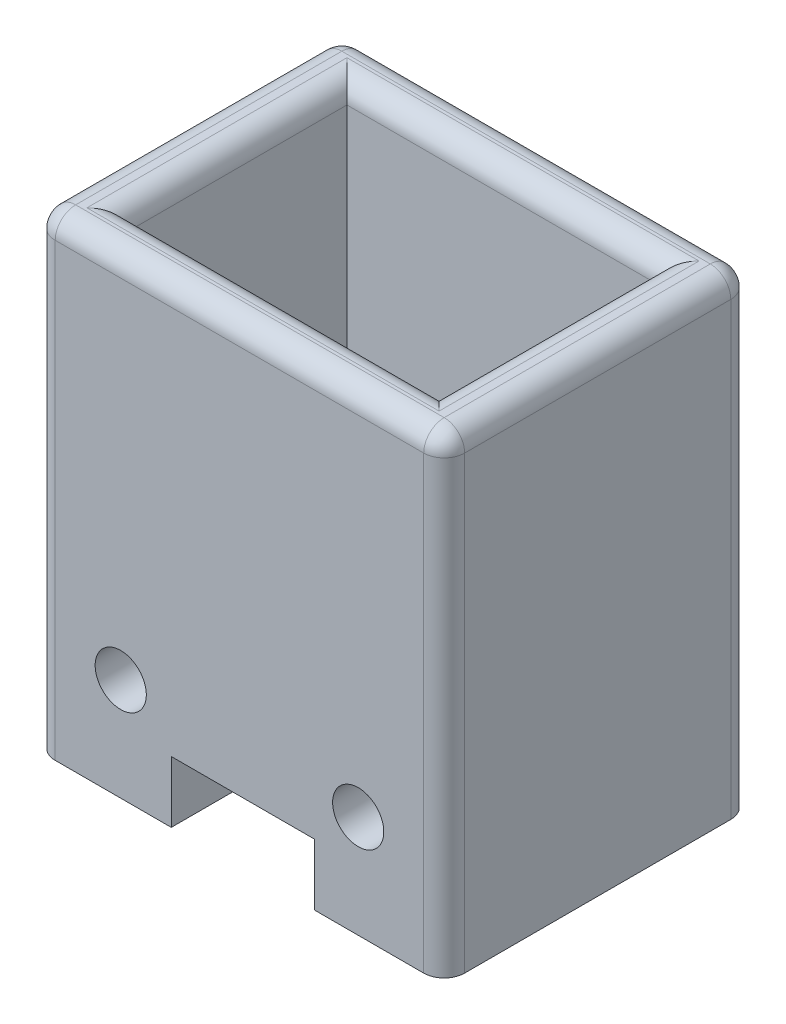
from build123d import *

# Parameters (mm, degrees)
SKETCH1_W           = 20
SKETCH1_H           = 15
SKETCH1_W_2         = 15.2
SKETCH1_H_2         = 10.7
BOSS_EXTRUDE1_DEPTH = 21
SKETCH2_W           = 20
SKETCH2_H           = 15
SKETCH2_W_2         = 6.666666666
SKETCH2_H_2         = 5
BOSS_EXTRUDE2_DEPTH = 2
HOLE1_START         = -7.5
HOLE1_OUTLINE_R     = 1.25
HOLE1_DEPTH         = 15
FILLET1_R           = 1
SKETCH4_W           = 7
SKETCH4_H           = 3
CUT_EXTRUDE1_DEPTH  = 28.676705006


# Read off the part's stored shape, not the designer's step: Hole1
with BuildPart() as part:
    # Sketch1 → Boss-Extrude1 (new body)
    with BuildSketch(Plane(origin=(0, 0, 0), x_dir=(1, 0, 0), z_dir=(0, 1, 0))):
        Rectangle(SKETCH1_W, SKETCH1_H)
        Rectangle(SKETCH1_W_2, SKETCH1_H_2, mode=Mode.SUBTRACT)
    extrude(amount=BOSS_EXTRUDE1_DEPTH)

    # Sketch2 → Boss-Extrude2 (add)
    with BuildSketch(Plane.XZ):
        Rectangle(SKETCH2_W, SKETCH2_H)
        Rectangle(SKETCH2_W_2, SKETCH2_H_2, mode=Mode.SUBTRACT)
    extrude(amount=BOSS_EXTRUDE2_DEPTH)

    # Hole1 outline → Hole1 (cut)
    with BuildSketch(Plane.XY.offset(HOLE1_START)):
        with Locations((5.8, 3)):
            Circle(HOLE1_OUTLINE_R)
        with Locations((-5.8, 3)):
            Circle(HOLE1_OUTLINE_R)
    extrude(amount=HOLE1_DEPTH, mode=Mode.SUBTRACT)

    # Fillet1
    fillet1_edges = [part.edges().sort_by_distance(p)[0] for p in [
        (-10, 21, 0),
        (7.6, 21, 0),
        (0, 21, 7.5),
        (0, 21, -5.35),
        (-7.6, 21, 0),
        (0, 21, 5.35),
        (10, 21, 0),
        (10, 9.5, 7.5),
        (-10, 9.5, 7.5),
        (-10, 9.5, -7.5),
        (10, 9.5, -7.5),
        (0, 21, -7.5),
    ]]
    fillet(fillet1_edges, radius=FILLET1_R)

    # Sketch4 → Cut-Extrude1 (cut, through all)
    with BuildSketch(Plane.XY.offset(7.5)):
        with Locations((0.17, -0.5)):
            Rectangle(SKETCH4_W, SKETCH4_H)
    extrude(amount=-CUT_EXTRUDE1_DEPTH, mode=Mode.SUBTRACT)


solid = part.part
